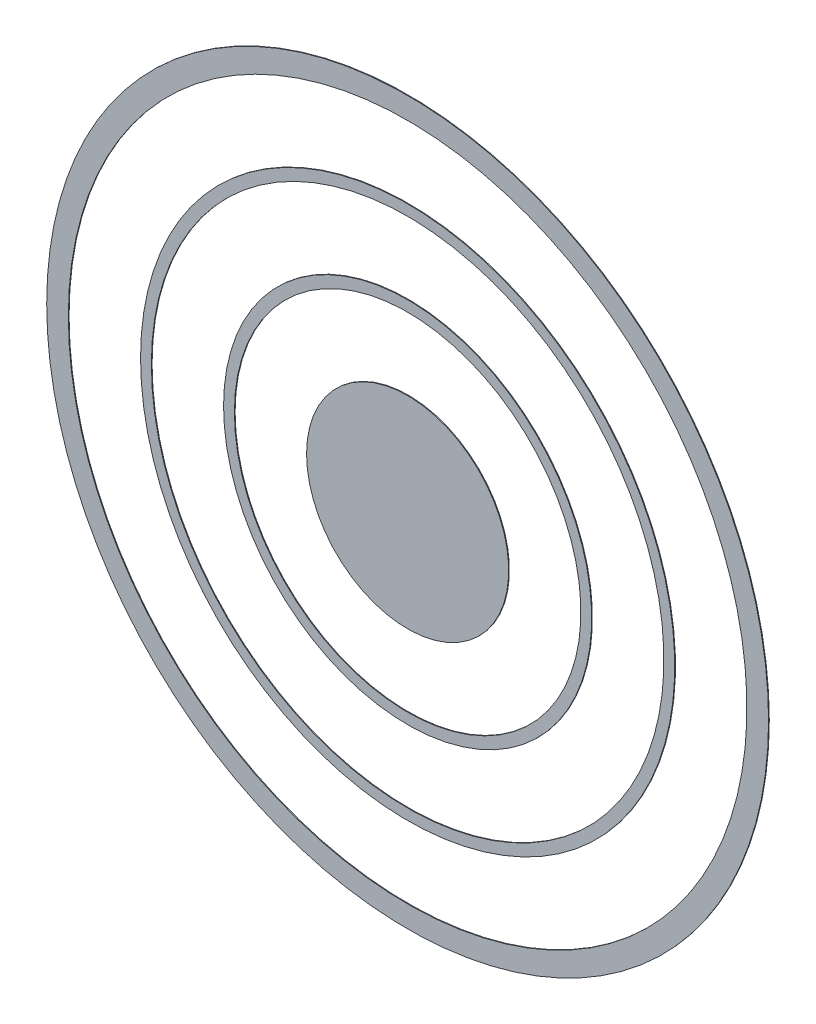
from build123d import *

# Parameters (mm, degrees)
SKETCH_1_R        = 5
SKETCH_1_R_2      = 4.7
EXTRUDE_1_DEPTH   = 0.01
SKETCH_1_R_3      = 3.7
SKETCH_1_R_4      = 3.55
EXTRUDE_1_2_DEPTH = 0.01
SKETCH_1_R_5      = 1.4
EXTRUDE_1_3_DEPTH = 0.01
SKETCH_1_R_6      = 2.55
SKETCH_1_R_7      = 2.4
EXTRUDE_1_4_DEPTH = 0.01


with BuildPart() as part:
    # Эскиз1 → Бобышка-Вытянуть1 (new body)
    with BuildSketch(Plane.XY):
        Circle(SKETCH_1_R)
        Circle(SKETCH_1_R_2, mode=Mode.SUBTRACT)
    extrude(amount=EXTRUDE_1_DEPTH)


with BuildPart() as body_2:
    # Эскиз1 → Extrude 1 2 (new body)
    with BuildSketch(Plane.XY):
        Circle(SKETCH_1_R_3)
        Circle(SKETCH_1_R_4, mode=Mode.SUBTRACT)
    extrude(amount=EXTRUDE_1_2_DEPTH)


with BuildPart() as body_3:
    # Эскиз1 → Extrude 1 3 (new body)
    with BuildSketch(Plane.XY):
        Circle(SKETCH_1_R_5)
    extrude(amount=EXTRUDE_1_3_DEPTH)


with BuildPart() as body_4:
    # Эскиз1 → Extrude 1 4 (new body)
    with BuildSketch(Plane.XY):
        Circle(SKETCH_1_R_6)
        Circle(SKETCH_1_R_7, mode=Mode.SUBTRACT)
    extrude(amount=EXTRUDE_1_4_DEPTH)


solid = Compound([part.part, body_2.part, body_3.part, body_4.part])
